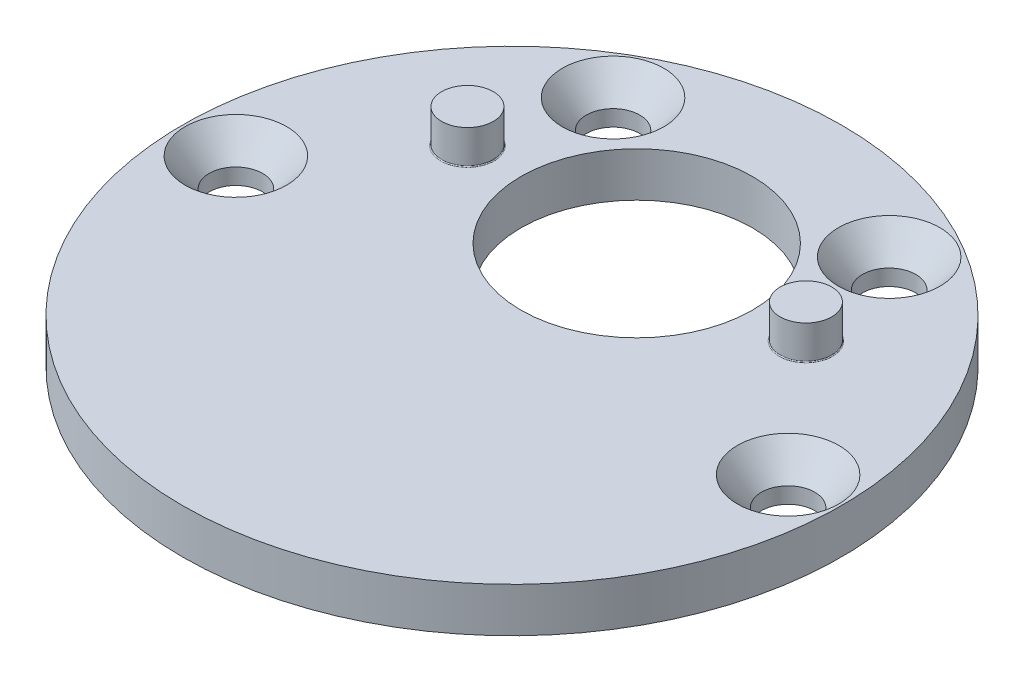
from build123d import *

# Parameters (mm, degrees)
SKETCH1_R           = 18.5
SKETCH1_R_2         = 1.5
BOSS_EXTRUDE1_DEPTH = 2.5
SKETCH2_R           = 1.45
BOSS_EXTRUDE2_DEPTH = 1.9
FILLET1_R           = 0.05
SKETCH4_R           = 6.5
CUT_EXTRUDE1_DEPTH  = 27.282123202
CHAMFER1_SIZE       = 1.35
CHAMFER1_SIZE2      = 1.6


with BuildPart() as part:
    # Sketch1 → Boss-Extrude1 (new body)
    with BuildSketch(Plane(origin=(0, 0, 0), x_dir=(1, 0, 0), z_dir=(0, 1, 0))):
        Circle(SKETCH1_R)
        with Locations((-7.75, 13.423393759)):
            Circle(SKETCH1_R_2, mode=Mode.SUBTRACT)
        with Locations((-15.5, 0)):
            Circle(SKETCH1_R_2, mode=Mode.SUBTRACT)
        with Locations((7.75, 13.423393759)):
            Circle(SKETCH1_R_2, mode=Mode.SUBTRACT)
        with Locations((15.5, 0)):
            Circle(SKETCH1_R_2, mode=Mode.SUBTRACT)
    extrude(amount=BOSS_EXTRUDE1_DEPTH)

    # Sketch2 → Boss-Extrude2 (add)
    with BuildSketch(Plane(origin=(0, 2.5, 0), x_dir=(1, 0, 0), z_dir=(0, 1, 0))):
        with Locations((-9.5, 7)):
            Circle(SKETCH2_R)
        with Locations((9.5, 7)):
            Circle(SKETCH2_R)
    extrude(amount=BOSS_EXTRUDE2_DEPTH)

    # Fillet1
    fillet1_edges = [part.edges().sort_by_distance(p)[0] for p in [
        (8.05, 2.5, -7),
        (-10.95, 2.5, -7),
    ]]
    fillet(fillet1_edges, radius=FILLET1_R)

    # Sketch4 → Cut-Extrude1 (cut, through all)
    with BuildSketch(Plane(origin=(0, 2.5, 0), x_dir=(1, 0, 0), z_dir=(0, 1, 0))):
        with Locations((0, 7)):
            Circle(SKETCH4_R)
    extrude(amount=-CUT_EXTRUDE1_DEPTH, mode=Mode.SUBTRACT)

    # Chamfer1
    chamfer1_edges = [part.edges().sort_by_distance(p)[0] for p in [
        (-17, 2.5, 0),
        (14, 2.5, 0),
        (6.25, 2.5, -13.423393759),
        (-9.25, 2.5, -13.423393759),
    ]]
    chamfer1_side = [part.faces().sort_by_distance(p)[0] for p in [
        (0, 2.5, 1.353072502),
    ]]
    chamfer(chamfer1_edges, length=CHAMFER1_SIZE, length2=CHAMFER1_SIZE2, reference=chamfer1_side[0])


solid = part.part
